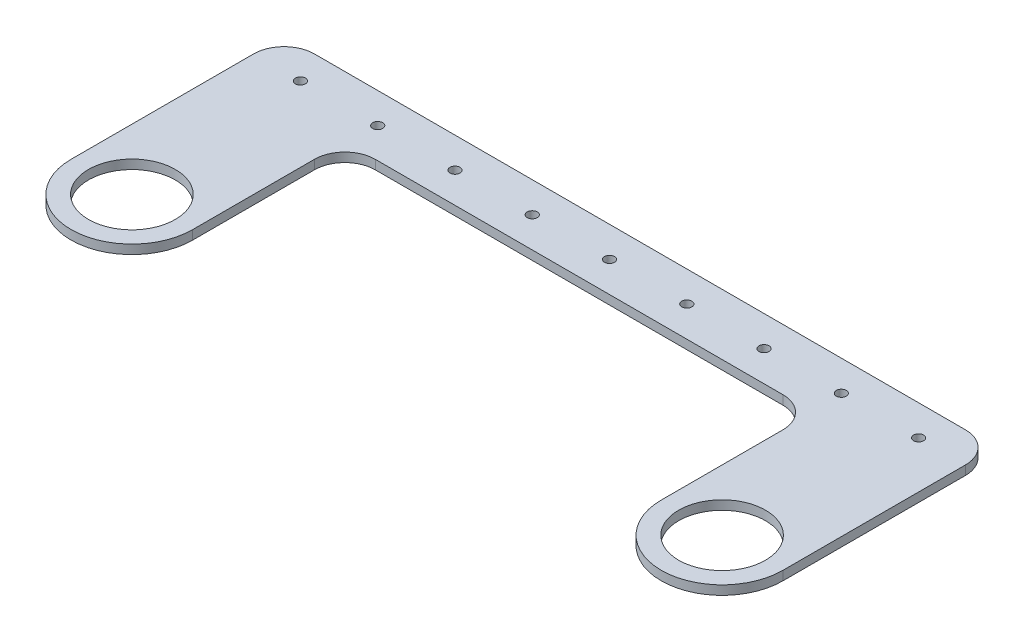
from build123d import *

# Parameters (mm, degrees)
SKETCH1_R           = 1.65
SKETCH1_R_2         = 14.26
BOSS_EXTRUDE1_DEPTH = 3
FILLET1_R           = 10


with BuildPart() as part:
    # Sketch1 → Boss-Extrude1 (new body)
    with BuildSketch(Plane(origin=(0, 0, 0), x_dir=(1, 0, 0), z_dir=(0, 1, 0))):
        with BuildLine():
            Line((-77, -10), (77, -10))
            Line((77, -10), (77, -60))
            ThreePointArc((77, -60), (97, -80), (117, -60))
            Line((117, -60), (117, 10))
            Line((117, 10), (-117, 10))
            Line((-117, 10), (-117, -60))
            ThreePointArc((-117, -60), (-97, -80), (-77, -60))
            Line((-77, -60), (-77, -10))
        make_face()
        with Locations((-76.2, 0)):
            Circle(SKETCH1_R, mode=Mode.SUBTRACT)
        with Locations((76.2, 0)):
            Circle(SKETCH1_R, mode=Mode.SUBTRACT)
        with Locations((-50.8, 0)):
            Circle(SKETCH1_R, mode=Mode.SUBTRACT)
        with Locations((-25.4, 0)):
            Circle(SKETCH1_R, mode=Mode.SUBTRACT)
        Circle(SKETCH1_R, mode=Mode.SUBTRACT)
        with Locations((25.4, 0)):
            Circle(SKETCH1_R, mode=Mode.SUBTRACT)
        with Locations((50.8, 0)):
            Circle(SKETCH1_R, mode=Mode.SUBTRACT)
        with Locations((-101.6, 0)):
            Circle(SKETCH1_R, mode=Mode.SUBTRACT)
        with Locations((101.6, 0)):
            Circle(SKETCH1_R, mode=Mode.SUBTRACT)
        with Locations((-97, -60)):
            Circle(SKETCH1_R_2, mode=Mode.SUBTRACT)
        with Locations((97, -60)):
            Circle(SKETCH1_R_2, mode=Mode.SUBTRACT)
    extrude(amount=BOSS_EXTRUDE1_DEPTH)

    # Fillet1
    fillet1_edges = [part.edges().sort_by_distance(p)[0] for p in [
        (117, 1.5, -10),
        (-117, 1.5, -10),
        (77, 1.5, 10),
        (-77, 1.5, 10),
    ]]
    fillet(fillet1_edges, radius=FILLET1_R)


solid = part.part
